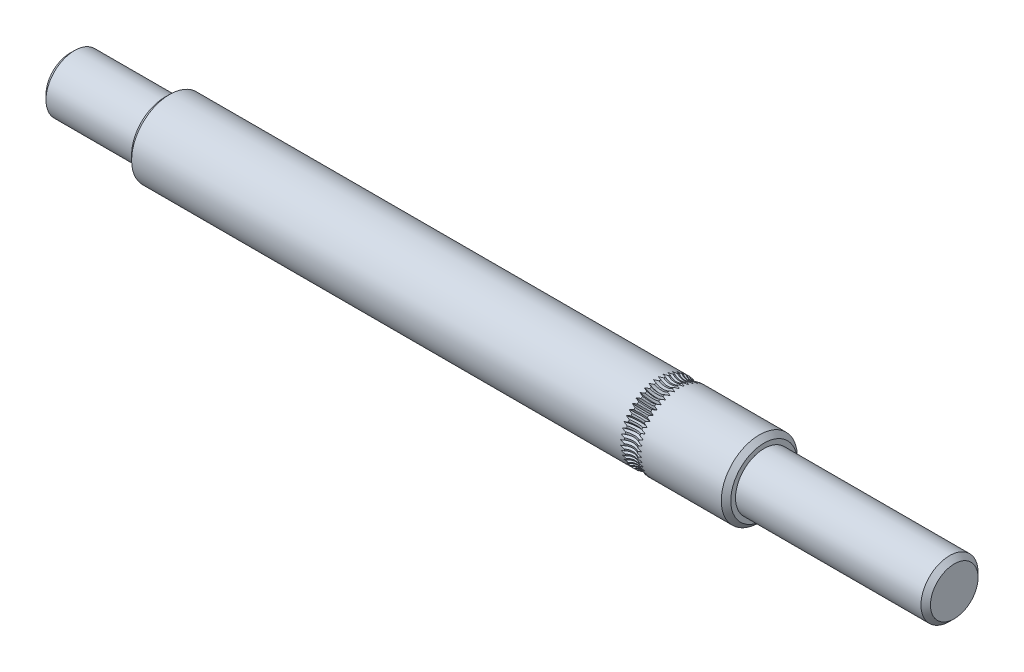
from build123d import *

# Parameters (mm, degrees)
CHAMFER1_SIZE     = 0.5
CIRPATTERN1_COUNT = 50


with BuildPart() as part:
    # Sketch1 → Revolve1 (revolve)
    with BuildSketch(Plane.XY):
        Polygon((-53, 4), (10, 4), (10, 3), (30, 3), (30, 0), (-63, 0), (-63, 3), (-53, 3), align=None)
    revolve(axis=Axis((0, 0, 0), (1, 0, 0)))

    # Chamfer1
    chamfer1_edges = [part.edges().sort_by_distance(p)[0] for p in [
        (30, -3, 0),
        (10, -4, 0),
        (-53, -4, 0),
        (-63, -3, 0),
    ]]
    chamfer(chamfer1_edges, length=CHAMFER1_SIZE)

    # Sketch2 → Cut-Revolve1 (revolve, cut)
    with BuildSketch(Plane(origin=(0, 0, 0), x_dir=(0, 0, -1), z_dir=(1, 0, 0))):
        Polygon((0.156173248, 3.7705), (0, 3.5), (-0.156173248, 3.7705), (-1.3354137, 3.7705), (-1.3354137, 5), (1.3354137, 5), (1.3354137, 3.7705), align=None)
    cut_revolve1 = revolve(axis=Axis((0, 5, -9.989903303), (0, 0, 1)), mode=Mode.SUBTRACT)

    # CirPattern1: Cut-Revolve1 ×50 about axis
    cirpattern1_axis = Axis((0, 0, 0), (-1, 0, 0))
    for i in range(1, CIRPATTERN1_COUNT):
        add(cut_revolve1.rotate(cirpattern1_axis, i * 360 / CIRPATTERN1_COUNT), mode=Mode.SUBTRACT)


solid = part.part
